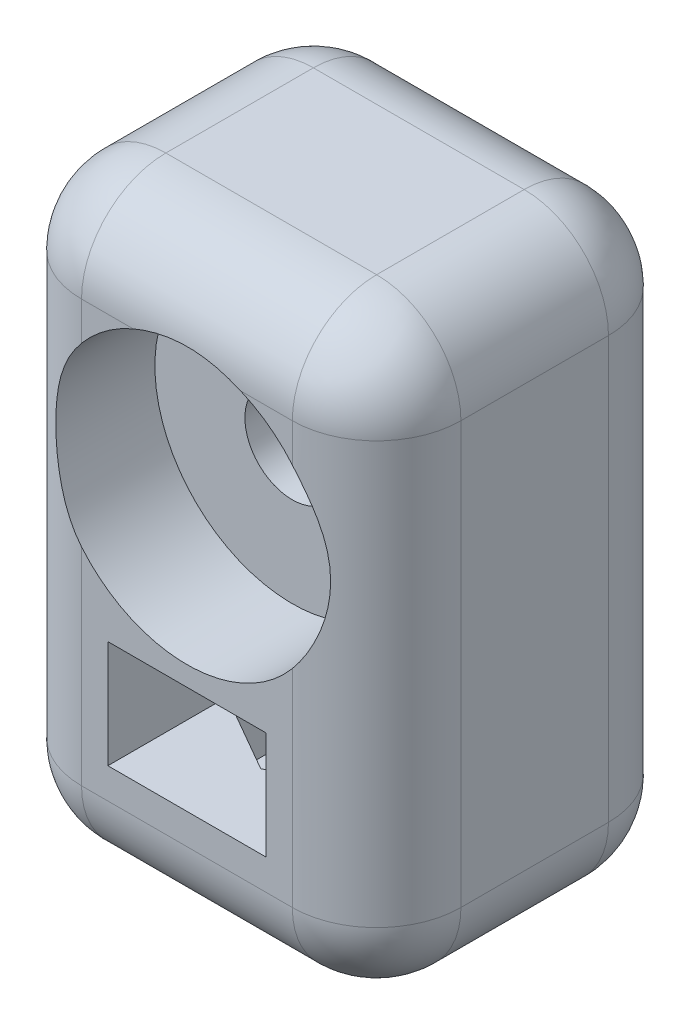
from build123d import *

# Parameters (mm, degrees)
SKETCH1_R           = 2.25
BOSS_EXTRUDE1_DEPTH = 7.5
CUT_EXTRUDE1_START  = -7.5
SKETCH1_3_R         = 6.52
SKETCH1_3_R_2       = 2.25
CUT_EXTRUDE1_DEPTH  = 5
CUT_EXTRUDE2_START  = 2.5
SKETCH1_4_R         = 6.52
SKETCH1_4_R_2       = 2.25
CUT_EXTRUDE2_DEPTH  = 5
FILLET1_R           = 4
SKETCH2_R           = 2.1
CUT_EXTRUDE3_DEPTH  = 10
SKETCH3_W           = 7.5
SKETCH3_H           = 5.1
CUT_EXTRUDE4_DEPTH  = 37.510272694
CUT_EXTRUDE5_START  = -2.45
SKETCH2_7_R         = 2.1
CUT_EXTRUDE5_DEPTH  = 3


with BuildPart() as part:
    # Sketch1 → Boss-Extrude1 (new, symmetric)
    with BuildSketch(Plane.XY):
        with BuildLine():
            Line((0, 0), (0, 24))
            ThreePointArc((0, 24), (1.171572875, 26.828427125), (4, 28))
            Line((4, 28), (14, 28))
            ThreePointArc((14, 28), (16.828427125, 26.828427125), (18, 24))
            Line((18, 24), (18, 0))
            Line((18, 0), (0, 0))
        make_face()
        with Locations((9, 18)):
            Circle(SKETCH1_R, mode=Mode.SUBTRACT)
    extrude(amount=BOSS_EXTRUDE1_DEPTH, both=True)

    # Sketch1<3> → Cut-Extrude1 (cut)
    with BuildSketch(Plane.XY.offset(CUT_EXTRUDE1_START)):
        with Locations((9, 18)):
            Circle(SKETCH1_3_R)
        with Locations((9, 18)):
            Circle(SKETCH1_3_R_2, mode=Mode.SUBTRACT)
    extrude(amount=CUT_EXTRUDE1_DEPTH, mode=Mode.SUBTRACT)

    # Sketch1<4> → Cut-Extrude2 (cut)
    with BuildSketch(Plane.XY.offset(CUT_EXTRUDE2_START)):
        with Locations((9, 18)):
            Circle(SKETCH1_4_R)
        with Locations((9, 18)):
            Circle(SKETCH1_4_R_2, mode=Mode.SUBTRACT)
    extrude(amount=CUT_EXTRUDE2_DEPTH, mode=Mode.SUBTRACT)

    # Fillet1
    # the kernel refuses this fillet: 4 mm, written as the material it takes off along each edge
    with BuildSketch(Plane(origin=(4, 4, -3.5), x_dir=(0, -1, 0), z_dir=(-1, 0, 0))) as fillet1_piece_1_section:
        Polygon((0, 0), (FILLET1_R, 0), (FILLET1_R, -FILLET1_R), (0, -FILLET1_R), align=None)
    fillet1_piece_1 = extrude(amount=FILLET1_R, mode=Mode.PRIVATE)
    fillet1_piece_1 = fillet1_piece_1 - Plane(origin=(4, 4, -3.5), x_dir=(0, 0.7071067811865475, 0.7071067811865475), z_dir=(-1, 0, 0)) * Sphere(FILLET1_R, mode=Mode.PRIVATE)
    add(fillet1_piece_1, mode=Mode.SUBTRACT)
    with BuildSketch(Plane(origin=(4, 4, 3.5), x_dir=(0, -1, 0), z_dir=(-1, 0, 0))) as fillet1_piece_2_section:
        Polygon((0, 0), (FILLET1_R, 0), (FILLET1_R, FILLET1_R), (0, FILLET1_R), align=None)
    fillet1_piece_2 = extrude(amount=FILLET1_R, mode=Mode.PRIVATE)
    fillet1_piece_2 = fillet1_piece_2 - Plane(origin=(4, 4, 3.5), x_dir=(0, 0.7071067811865475, -0.7071067811865475), z_dir=(-1, 0, 0)) * Sphere(FILLET1_R, mode=Mode.PRIVATE)
    add(fillet1_piece_2, mode=Mode.SUBTRACT)
    with BuildSketch(Plane(origin=(14, 4, -3.5), x_dir=(0, 0, -1), z_dir=(0, -1, 0))) as fillet1_piece_3_section:
        Polygon((0, 0), (FILLET1_R, 0), (FILLET1_R, FILLET1_R), (0, FILLET1_R), align=None)
    fillet1_piece_3 = extrude(amount=FILLET1_R, mode=Mode.PRIVATE)
    fillet1_piece_3 = fillet1_piece_3 - Plane(origin=(14, 4, -3.5), x_dir=(-0.7071067811865475, 0, 0.7071067811865475), z_dir=(0, -1, 0)) * Sphere(FILLET1_R, mode=Mode.PRIVATE)
    add(fillet1_piece_3, mode=Mode.SUBTRACT)
    with BuildSketch(Plane(origin=(14, 4, 3.5), x_dir=(0, 0, 1), z_dir=(0, -1, 0))) as fillet1_piece_4_section:
        Polygon((0, 0), (FILLET1_R, 0), (FILLET1_R, -FILLET1_R), (0, -FILLET1_R), align=None)
    fillet1_piece_4 = extrude(amount=FILLET1_R, mode=Mode.PRIVATE)
    fillet1_piece_4 = fillet1_piece_4 - Plane(origin=(14, 4, 3.5), x_dir=(-0.7071067811865475, 0, -0.7071067811865475), z_dir=(0, -1, 0)) * Sphere(FILLET1_R, mode=Mode.PRIVATE)
    add(fillet1_piece_4, mode=Mode.SUBTRACT)
    with BuildSketch(Plane(origin=(0, 4, -7.5), x_dir=(0, 0, 1), z_dir=(0, 1, 0)), Plane(origin=(18, 24, 7.5), x_dir=(-1, 0, 0), z_dir=(0, -1, 0))) as fillet1_piece_5:
        with BuildLine():
            CenterArc((FILLET1_R, FILLET1_R), FILLET1_R, 180, 90)
            Line((0, FILLET1_R), (0, 0))
            Line((0, 0), (FILLET1_R, 0))
        make_face()
    extrude(amount=20, mode=Mode.SUBTRACT)
    with BuildSketch(Plane(origin=(4, 24, -7.5), x_dir=(-1, 0, 0), z_dir=(0, -1, 0))) as fillet1_piece_6:
        with BuildLine():
            CenterArc((4 - FILLET1_R, -FILLET1_R), FILLET1_R, 0, 90)
            Line((4, -FILLET1_R), (4, 0))
            Line((4, 0), (4 - FILLET1_R, 0))
        make_face()
    revolve(axis=Axis((4, 24, -7.5), (0, 0, -1)), revolution_arc=90, mode=Mode.SUBTRACT)
    with BuildSketch(Plane(origin=(0, 4, 7.5), x_dir=(0, 0, -1), z_dir=(0, 1, 0)), Plane(origin=(18, 24, -7.5), x_dir=(-1, 0, 0), z_dir=(0, -1, 0))) as fillet1_piece_7:
        with BuildLine():
            CenterArc((FILLET1_R, -FILLET1_R), FILLET1_R, 90, 90)
            Line((0, -FILLET1_R), (0, 0))
            Line((0, 0), (FILLET1_R, 0))
        make_face()
    extrude(amount=20, mode=Mode.SUBTRACT)
    with BuildSketch(Plane(origin=(18, 0, -3.5), x_dir=(-1, 0, 0), z_dir=(0, 0, 1)), Plane(origin=(0, 0, -3.5), x_dir=(0, 1, 0), z_dir=(0, 0, 1))) as fillet1_piece_8:
        with BuildLine():
            CenterArc((FILLET1_R, -FILLET1_R), FILLET1_R, 90, 90)
            Line((0, -FILLET1_R), (0, 0))
            Line((0, 0), (FILLET1_R, 0))
        make_face()
    extrude(amount=7, mode=Mode.SUBTRACT)
    with BuildSketch(Plane(origin=(14, 0, 7.5), x_dir=(0, 0, -1), z_dir=(-1, 0, 0)), Plane(origin=(4, 28, -7.5), x_dir=(0, -1, 0), z_dir=(1, 0, 0))) as fillet1_piece_9:
        with BuildLine():
            CenterArc((FILLET1_R, -FILLET1_R), FILLET1_R, 90, 90)
            Line((0, -FILLET1_R), (0, 0))
            Line((0, 0), (FILLET1_R, 0))
        make_face()
    extrude(amount=10, mode=Mode.SUBTRACT)
    with BuildSketch(Plane(origin=(14, 24, 7.5), x_dir=(0, 1, 0), z_dir=(-1, 0, 0))) as fillet1_piece_10:
        with BuildLine():
            CenterArc((4 - FILLET1_R, FILLET1_R), FILLET1_R, 270, 90)
            Line((4, FILLET1_R), (4, 0))
            Line((4, 0), (4 - FILLET1_R, 0))
        make_face()
    revolve(axis=Axis((14, 24, 7.5), (0, 0, -1)), revolution_arc=90, mode=Mode.SUBTRACT)
    with BuildSketch(Plane(origin=(4, 28, 7.5), x_dir=(0, -1, 0), z_dir=(1, 0, 0)), Plane(origin=(14, 0, -7.5), x_dir=(0, 0, 1), z_dir=(-1, 0, 0))) as fillet1_piece_11:
        with BuildLine():
            CenterArc((FILLET1_R, FILLET1_R), FILLET1_R, 180, 90)
            Line((0, FILLET1_R), (0, 0))
            Line((0, 0), (FILLET1_R, 0))
        make_face()
    extrude(amount=10, mode=Mode.SUBTRACT)
    with BuildSketch(Plane(origin=(14, 24, -7.5), x_dir=(0, 1, 0), z_dir=(-1, 0, 0))) as fillet1_piece_12:
        with BuildLine():
            CenterArc((4 - FILLET1_R, -FILLET1_R), FILLET1_R, 0, 90)
            Line((4, -FILLET1_R), (4, 0))
            Line((4, 0), (4 - FILLET1_R, 0))
        make_face()
    revolve(axis=Axis((14, 24, -7.5), (0, 0, -1)), revolution_arc=90, mode=Mode.SUBTRACT)
    with BuildSketch(Plane(origin=(4, 24, 7.5), x_dir=(-1, 0, 0), z_dir=(0, -1, 0))) as fillet1_piece_13:
        with BuildLine():
            CenterArc((4 - FILLET1_R, FILLET1_R), FILLET1_R, 270, 90)
            Line((4 - FILLET1_R, 0), (4, 0))
            Line((4, 0), (4, FILLET1_R))
        make_face()
    revolve(axis=Axis((4, 24, 7.5), (0, 0, -1)), revolution_arc=90, mode=Mode.SUBTRACT)

    # Sketch2 → Cut-Extrude3 (cut)
    with BuildSketch(Plane.XZ):
        with Locations((9, 0)):
            Circle(SKETCH2_R)
    extrude(amount=-CUT_EXTRUDE3_DEPTH, mode=Mode.SUBTRACT)

    # Sketch3 → Cut-Extrude4 (cut, through all)
    with BuildSketch(Plane(origin=(0, 0, -7.5), x_dir=(-1, 0, 0), z_dir=(0, 0, -1))):
        with Locations((-9, 8)):
            Rectangle(SKETCH3_W, SKETCH3_H)
    extrude(amount=-CUT_EXTRUDE4_DEPTH, mode=Mode.SUBTRACT)

    # Sketch2<7> → Cut-Extrude5 (cut)
    with BuildSketch(Plane.XZ.offset(CUT_EXTRUDE5_START)):
        Polygon((12.461165772, -2.005076432), (12.467030013, 1.994919269), (9.005864241, 3.999995701), (5.538834228, 2.005076432), (5.532969987, -1.994919269), (8.994135759, -3.999995701), align=None)
        with Locations((9, 0)):
            Circle(SKETCH2_7_R, mode=Mode.SUBTRACT)
    extrude(amount=-CUT_EXTRUDE5_DEPTH, mode=Mode.SUBTRACT)


solid = part.part
